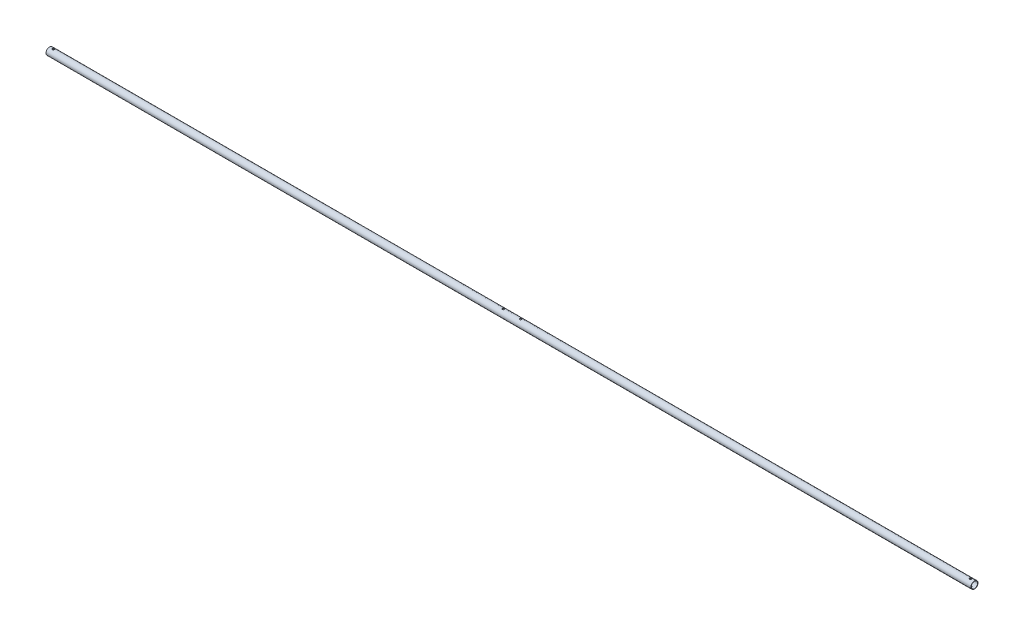
from build123d import *

# Parameters (mm, degrees)
SKETCH3_R               = 11.7094
SKETCH3_R_2             = 10.4648
BOSS_EXTRUDE1_DEPTH     = 3048
CUT_EXTRUDE1_DEPTH      = 3049.04498328
CUT_EXTRUDE1_DEPTH_BACK = 3049.04498328
SKETCH4_R               = 3.175
CUT_EXTRUDE2_DEPTH      = 3049.04498338
CUT_EXTRUDE2_DEPTH_BACK = 3049.04498338
SKETCH5_R               = 3.175


with BuildPart() as part:
    # Sketch3 → Boss-Extrude1 (new body)
    with BuildSketch(Plane(origin=(0, 0, 0), x_dir=(0, 0, -1), z_dir=(1, 0, 0))):
        Circle(SKETCH3_R)
        Circle(SKETCH3_R_2, mode=Mode.SUBTRACT)
    extrude(amount=BOSS_EXTRUDE1_DEPTH)

    # Sketch4 → Cut-Extrude1 (cut, two sides: drawn at the far end of the back side and taken through both)
    with BuildSketch(Plane(origin=(0, 0, 0), x_dir=(1, 0, 0), z_dir=(0, 1, 0)).offset(-CUT_EXTRUDE1_DEPTH_BACK)):
        with Locations((1495.425, 0)):
            Circle(SKETCH4_R)
        with Locations((1552.575, 0)):
            Circle(SKETCH4_R)
    extrude(amount=CUT_EXTRUDE1_DEPTH + CUT_EXTRUDE1_DEPTH_BACK, mode=Mode.SUBTRACT)

    # Sketch5 → Cut-Extrude2 (cut, two sides: drawn at the far end of the back side and taken through both)
    with BuildSketch(Plane(origin=(0, 0, 0), x_dir=(1, 0, 0), z_dir=(0, 1, 0)).offset(-CUT_EXTRUDE2_DEPTH_BACK)):
        with Locations((12.7, 0)):
            Circle(SKETCH5_R)
        with Locations((3035.3, 0)):
            Circle(SKETCH5_R)
    extrude(amount=CUT_EXTRUDE2_DEPTH + CUT_EXTRUDE2_DEPTH_BACK, mode=Mode.SUBTRACT)


solid = part.part
